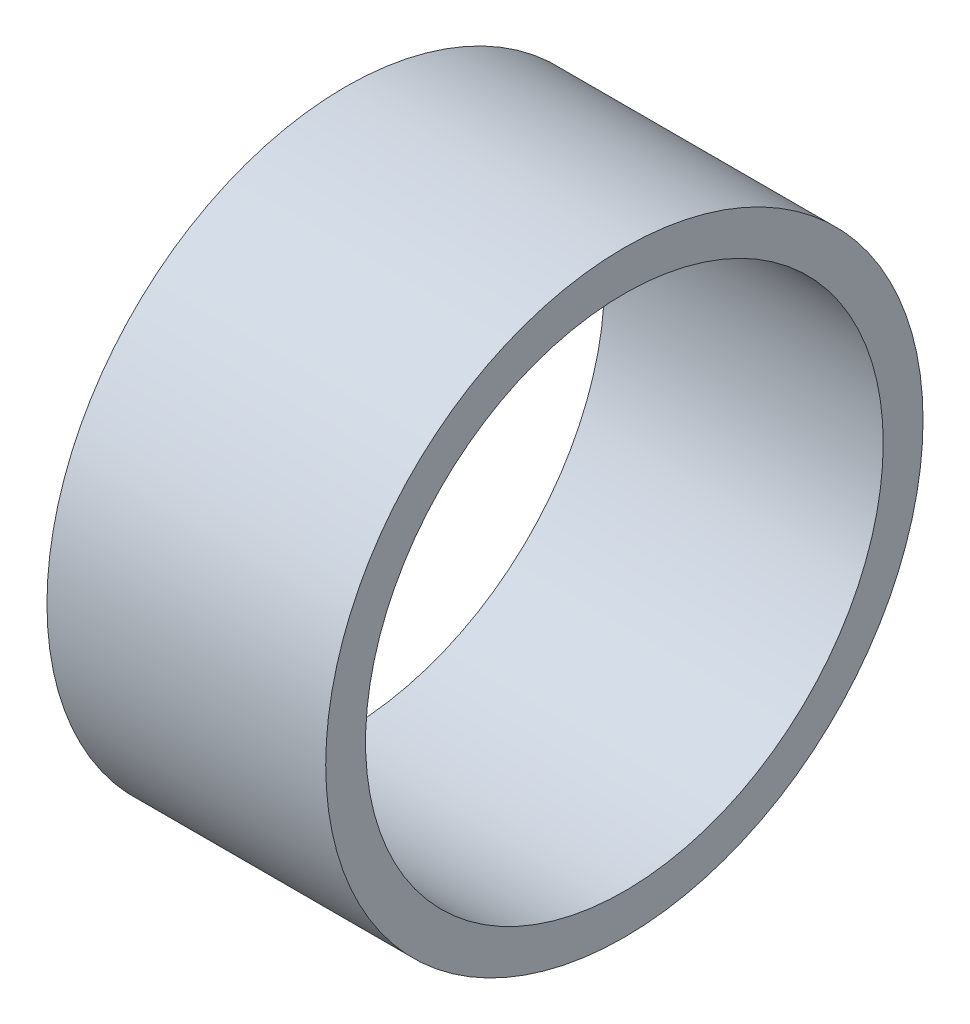
from build123d import *

# Parameters (mm, degrees)
SKETCH1_R           = 23.8125
SKETCH1_R_2         = 20.6375
BOSS_EXTRUDE1_DEPTH = 11.1125


with BuildPart() as part:
    # Sketch1 → Boss-Extrude1 (new, symmetric)
    with BuildSketch(Plane(origin=(0, 0, 0), x_dir=(0, 0, -1), z_dir=(1, 0, 0))):
        Circle(SKETCH1_R)
        Circle(SKETCH1_R_2, mode=Mode.SUBTRACT)
    extrude(amount=BOSS_EXTRUDE1_DEPTH, both=True)


solid = part.part
